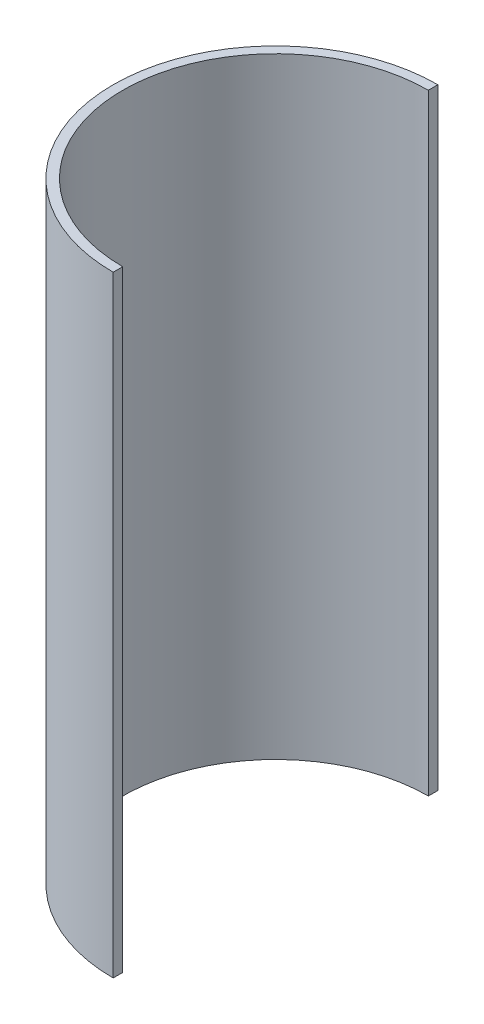
from build123d import *

# Parameters (mm, degrees)
BOSS_EXTRUDE1_DEPTH = 406.4


with BuildPart() as part:
    # Sketch1 → Boss-Extrude1 (new body)
    with BuildSketch(Plane(origin=(0, 0, 0), x_dir=(1, 0, 0), z_dir=(0, 1, 0))):
        with BuildLine():
            Line((0, 107.95), (0, 101.6))
            ThreePointArc((0, 101.6), (-101.6, 0), (0, -101.6))
            Line((0, -101.6), (0, -107.95))
            ThreePointArc((0, -107.95), (-107.95, 0), (0, 107.95))
        make_face()
    extrude(amount=BOSS_EXTRUDE1_DEPTH)


solid = part.part
